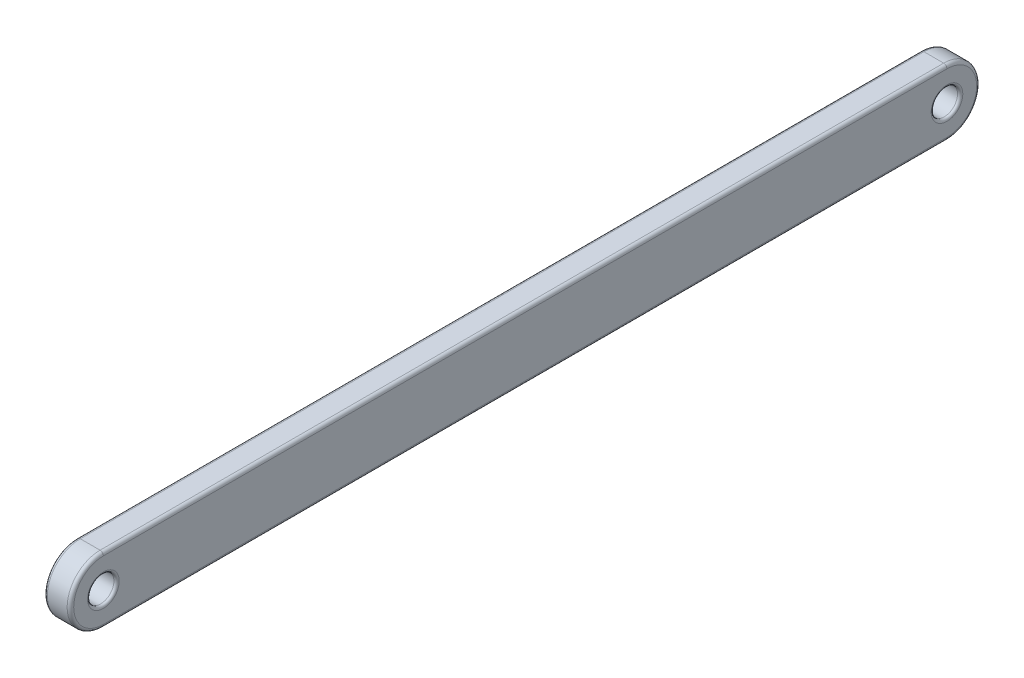
from build123d import *

# Parameters (mm, degrees)
SKETCH1_R           = 0.5
BOSS_EXTRUDE1_DEPTH = 1
FILLET1_R           = 0.125
FILLET2_R           = 0.1


with BuildPart() as part:
    # Sketch1 → Boss-Extrude1 (new body)
    with BuildSketch(Plane(origin=(0, 0, 0), x_dir=(0, 0, -1), z_dir=(1, 0, 0))):
        with BuildLine():
            Line((30, 0), (0, 0))
            Line((0, 0), (-1, 0))
            ThreePointArc((-1, 0), (-2.25, -1.25), (-1, -2.5))
            Line((-1, -2.5), (0, -2.5))
            Line((0, -2.5), (30, -2.5))
            Line((30, -2.5), (31, -2.5))
            ThreePointArc((31, -2.5), (32.25, -1.25), (31, 0))
            Line((31, 0), (30, 0))
        make_face()
        with Locations((-1, -1.25)):
            Circle(SKETCH1_R, mode=Mode.SUBTRACT)
        with Locations((31, -1.25)):
            Circle(SKETCH1_R, mode=Mode.SUBTRACT)
    extrude(amount=BOSS_EXTRUDE1_DEPTH)

    # Fillet1
    fillet1_edges = [part.edges().sort_by_distance(p)[0] for p in [
        (1, -1.25, -32.25),
        (1, 0, -15),
        (1, -1.25, 2.25),
        (0, -1.25, -32.25),
        (0, 0, -15),
        (0, -1.25, 2.25),
        (1, -2.5, -15),
        (0, -2.5, -15),
    ]]
    fillet(fillet1_edges, radius=FILLET1_R)

    # Fillet2
    fillet2_edges = [part.edges().sort_by_distance(p)[0] for p in [
        (0, -1.25, -30.5),
        (1, -1.25, -30.5),
        (0, -1.25, 1.5),
        (1, -1.25, 1.5),
    ]]
    fillet(fillet2_edges, radius=FILLET2_R)


solid = part.part
